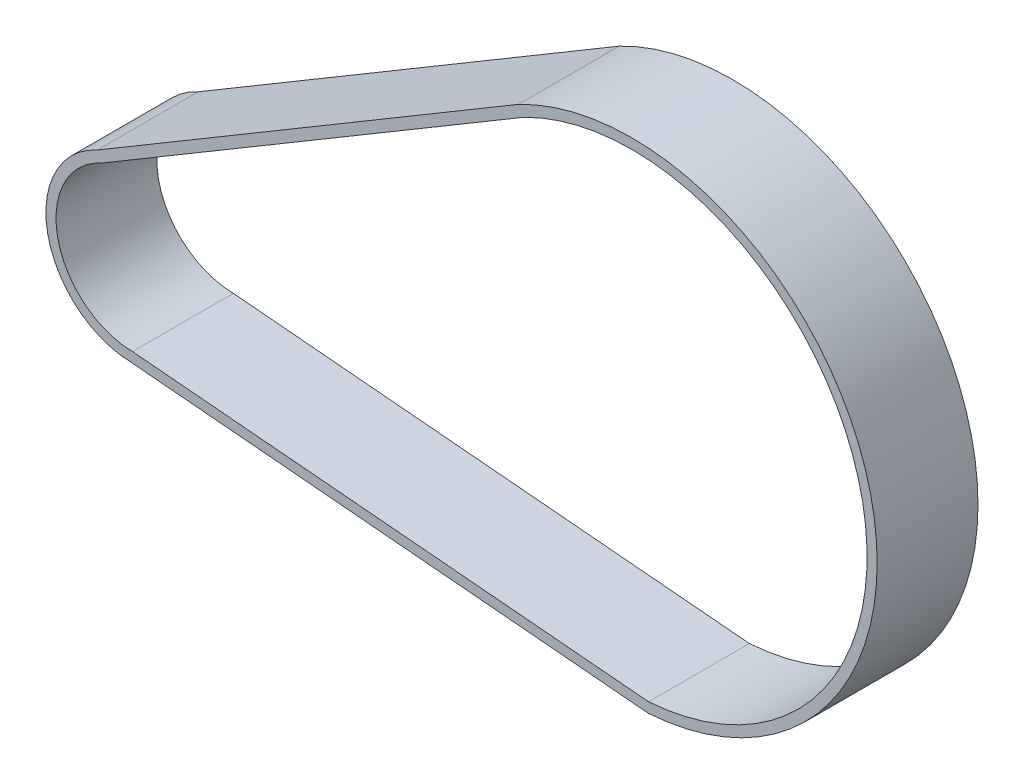
from build123d import *

# Parameters (mm, degrees)
BOSS_EXTRUDE1_DEPTH = 15


with BuildPart() as part:
    # Sketch1 → Boss-Extrude1 (new body)
    with BuildSketch(Plane.XY):
        with BuildLine():
            Line((-5.372111517, 11.838091816), (57.280184414, 49.047939663))
            ThreePointArc((57.280184414, 49.047939663), (109.284015224, 26.56109029), (76.625773309, -19.736815156))
            Line((76.625773309, -19.736815156), (-0.195954125, -12.998523069))
            ThreePointArc((-0.195954125, -12.998523069), (-12.726554856, -2.652320024), (-5.372111517, 11.838091816))
        make_face()
        with BuildLine():
            Line((-4.679285301, 10.504964973), (58.009935262, 47.736742741))
            ThreePointArc((58.009935262, 47.736742741), (107.829952613, 26.190761255), (76.639238125, -18.232237031))
            Line((76.639238125, -18.232237031), (-0.120675681, -11.499366825))
            ThreePointArc((-0.120675681, -11.499366825), (-11.260886325, -2.332903594), (-4.679285301, 10.504964973))
        make_face(mode=Mode.SUBTRACT)
    extrude(amount=BOSS_EXTRUDE1_DEPTH)


solid = part.part
